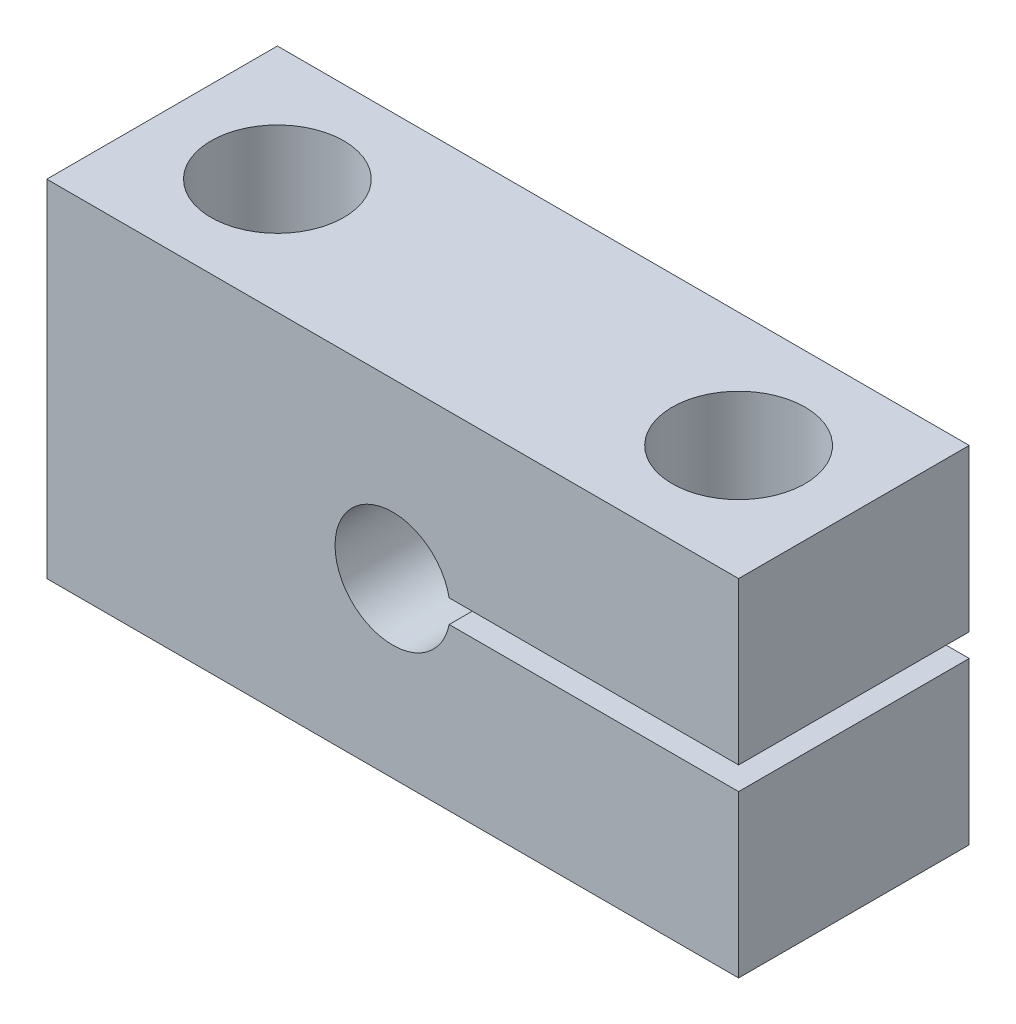
from build123d import *

# Parameters (mm, degrees)
BOSS_EXTRUDE1_DEPTH = 6.35
SKETCH2_R           = 1.8288
CUT_EXTRUDE1_DEPTH  = 15.892070037


with BuildPart() as part:
    # Sketch1 → Boss-Extrude1 (new body)
    with BuildSketch(Plane.XY):
        with BuildLine():
            Line((-9.525, -4.7625), (9.525, -4.7625))
            Line((9.525, -4.7625), (9.525, -0.3175))
            Line((9.525, -0.3175), (1.555425987, -0.3175))
            ThreePointArc((1.555425987, -0.3175), (-1.5875, 0), (1.555425987, 0.3175))
            Line((1.555425987, 0.3175), (9.525, 0.3175))
            Line((9.525, 0.3175), (9.525, 4.7625))
            Line((9.525, 4.7625), (-9.525, 4.7625))
            Line((-9.525, 4.7625), (-9.525, -4.7625))
        make_face()
    extrude(amount=BOSS_EXTRUDE1_DEPTH)

    # Sketch2 → Cut-Extrude1 (cut, through all)
    with BuildSketch(Plane.XZ.offset(4.7625)):
        with Locations((-6.35, 3.175)):
            Circle(SKETCH2_R)
        with Locations((6.35, 3.175)):
            Circle(SKETCH2_R)
    extrude(amount=-CUT_EXTRUDE1_DEPTH, mode=Mode.SUBTRACT)


solid = part.part
